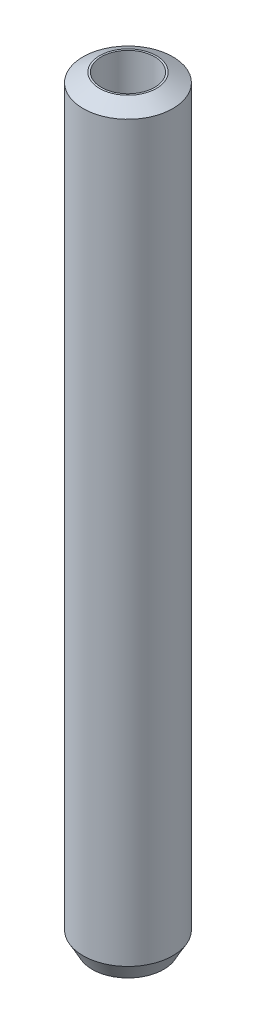
from build123d import *
from OCP.BRepFilletAPI import BRepFilletAPI_MakeChamfer

# Parameters (mm, degrees)
SKETCH1_R           = 25
BOSS_EXTRUDE1_DEPTH = 422.888548461
SKETCH2_R           = 14.82258006
CUT_EXTRUDE1_DEPTH  = 425.363905651
CHAMFER1_SIZE       = 5.101899936
CHAMFER1_SIZE2      = 9.174345545


with BuildPart() as part:
    # Sketch1 → Boss-Extrude1 (new body)
    with BuildSketch(Plane(origin=(0, 0, 0), x_dir=(1, 0, 0), z_dir=(0, 1, 0))):
        Circle(SKETCH1_R)
    extrude(amount=BOSS_EXTRUDE1_DEPTH)

    # Sketch2 → Cut-Extrude1 (cut, through all)
    with BuildSketch(Plane(origin=(0, 0, 0), x_dir=(1, 0, 0), z_dir=(0, 1, 0))):
        Circle(SKETCH2_R)
    extrude(amount=CUT_EXTRUDE1_DEPTH, mode=Mode.SUBTRACT)

    # Chamfer1: one chamfer whose edges measure the first distance from different faces: ONE call of the kernel's chamfer builder (chamfer() names one face for all edges)
    chamfer1_edges_1 = [part.edges().sort_by_distance(p)[0] for p in [
        (-25, 422.888548461, 0),
    ]]
    chamfer1_side_1 = [part.faces().sort_by_distance(p)[0] for p in [
        (-25, 211.44427423, 0),
    ]]
    chamfer1_edges_2 = [part.edges().sort_by_distance(p)[0] for p in [
        (-25, 0, 0),
    ]]
    chamfer1_side_2 = [part.faces().sort_by_distance(p)[0] for p in [
        (-24.292893219, 0, 0),
    ]]
    chamfer1 = BRepFilletAPI_MakeChamfer(part.part.solid().wrapped)
    for e in chamfer1_edges_1:
        chamfer1.Add(CHAMFER1_SIZE, CHAMFER1_SIZE2, e.wrapped, chamfer1_side_1[0].wrapped)  # the first distance lies on this face
    for e in chamfer1_edges_2:
        chamfer1.Add(CHAMFER1_SIZE, CHAMFER1_SIZE2, e.wrapped, chamfer1_side_2[0].wrapped)  # the first distance lies on this face
    add(Compound.cast(chamfer1.Shape()), mode=Mode.REPLACE)


solid = part.part
